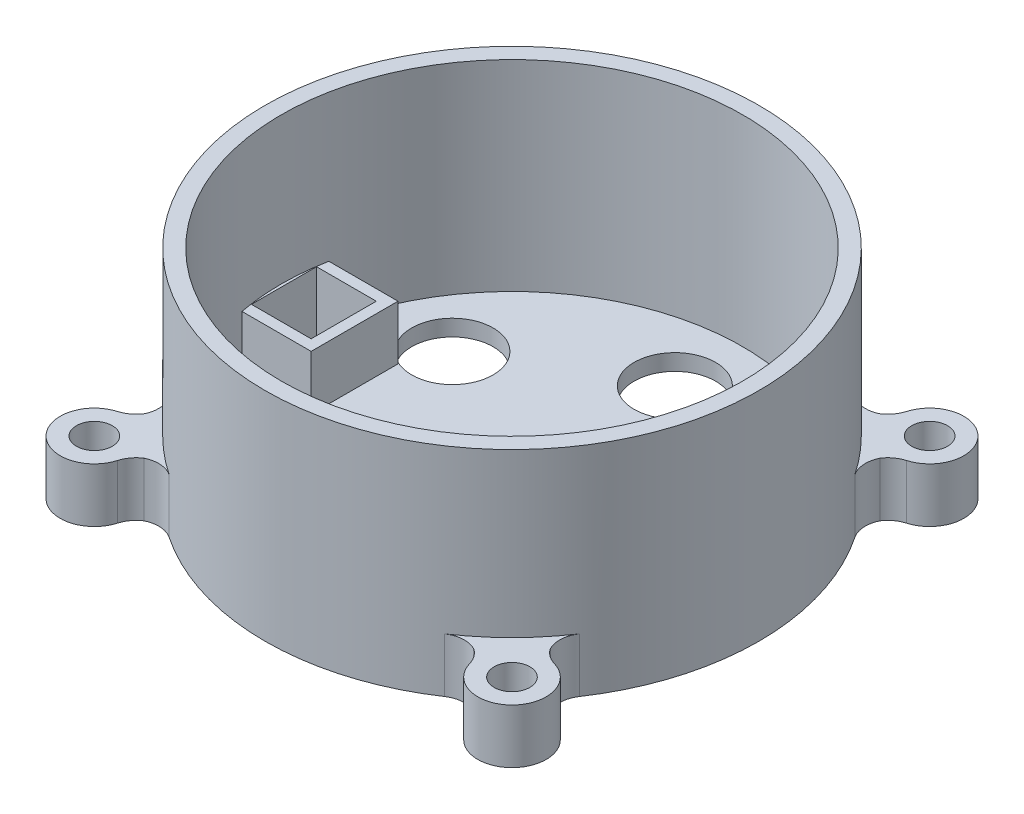
from build123d import *

# Parameters (mm, degrees)
SKETCH1_R               = 45.5
BOSS_EXTRUDE1_DEPTH     = 40
SHELL1_T                = -3
CUT_EXTRUDE2_DEPTH      = 76.766087401
CUT_EXTRUDE2_DEPTH_BACK = 76.766087401
SKETCH3_R               = 7.5
SKETCH4_R               = 3
CUT_EXTRUDE3_DEPTH      = 3
SKETCH6_W               = 15
SKETCH6_H               = 16
SKETCH6_W_2             = 11
SKETCH6_H_2             = 12
BOSS_EXTRUDE2_DEPTH     = 10
SKETCH7_W               = 11
SKETCH7_H               = 12
CUT_EXTRUDE5_DEPTH      = 3
SKETCH8_R               = 3.3
BOSS_EXTRUDE3_DEPTH     = 10
CIRPATTERN1_COUNT       = 4
FILLET1_R               = 5


with BuildPart() as part:
    # Sketch1 → Boss-Extrude1 (new body)
    with BuildSketch(Plane(origin=(0, 0, 0), x_dir=(1, 0, 0), z_dir=(0, 1, 0))):
        with Locations(Location((0, 0, 0), (0, 0, 270))):
            Circle(SKETCH1_R)
    extrude(amount=BOSS_EXTRUDE1_DEPTH)

    # Shell1
    shell1_openings = [part.faces().sort_by_distance(p)[0] for p in [
        (0, 40, 0),
    ]]
    offset(amount=SHELL1_T, openings=shell1_openings, kind=Kind.INTERSECTION)

    # Sketch3 → Cut-Extrude2 (cut, two sides: drawn at the far end of the back side and taken through both)
    with BuildSketch(Plane.XZ.offset(-CUT_EXTRUDE2_DEPTH_BACK)):
        with Locations(Location((0, 30, 0), (0, 0, 90))):
            Circle(SKETCH3_R)
        with Locations(Location((25.980762114, 15, 0), (0, 0, 90))):
            Circle(SKETCH3_R)
        with Locations(Location((25.980762114, -15, 0), (0, 0, 90))):
            Circle(SKETCH3_R)
        with Locations(Location((0, -30, 0), (0, 0, 90))):
            Circle(SKETCH3_R)
        with Locations(Location((-25.980762114, -15, 0), (0, 0, 90))):
            Circle(SKETCH3_R)
        with Locations(Location((-25.980762114, 15, 0), (0, 0, 90))):
            Circle(SKETCH3_R)
    extrude(amount=CUT_EXTRUDE2_DEPTH + CUT_EXTRUDE2_DEPTH_BACK, mode=Mode.SUBTRACT)

    # Sketch4 → Cut-Extrude3 (cut)
    with BuildSketch(Plane(origin=(0, 3, 0), x_dir=(1, 0, 0), z_dir=(0, 1, 0))):
        with Locations(Location((0, 0, 0), (0, 0, 270))):
            Circle(SKETCH4_R)
    extrude(amount=-CUT_EXTRUDE3_DEPTH, mode=Mode.SUBTRACT)

    # Sketch6 → Boss-Extrude2 (add)
    with BuildSketch(Plane(origin=(0, 3, 0), x_dir=(1, 0, 0), z_dir=(0, 1, 0))):
        with Locations((-36.5, 0)):
            Rectangle(SKETCH6_W, SKETCH6_H)
        with Locations((-36.5, 0)):
            Rectangle(SKETCH6_W_2, SKETCH6_H_2, mode=Mode.SUBTRACT)
    extrude(amount=BOSS_EXTRUDE2_DEPTH)

    # Sketch7 → Cut-Extrude5 (cut)
    with BuildSketch(Plane(origin=(0, 3, 0), x_dir=(1, 0, 0), z_dir=(0, 1, 0))):
        with Locations((-36.5, 0)):
            Rectangle(SKETCH7_W, SKETCH7_H)
    extrude(amount=-CUT_EXTRUDE5_DEPTH, mode=Mode.SUBTRACT)

    # Sketch8 → Boss-Extrude3 (add)
    with BuildSketch(Plane(origin=(0, 0, 0), x_dir=(1, 0, 0), z_dir=(0, 1, 0))):
        with BuildLine():
            Line((32.166608897, 38.466608897), (27.854823504, 35.97719844))
            ThreePointArc((27.854823504, 35.97719844), (32.173358544, 32.173358544), (35.97719844, 27.854823504))
            Line((35.97719844, 27.854823504), (38.466608897, 32.166608897))
            ThreePointArc((38.466608897, 32.166608897), (42.921381618, 42.921381618), (32.166608897, 38.466608897))
        make_face()
        with Locations(Location((38.466608897, 38.466608897, 0), (0, 0, 270))):
            Circle(SKETCH8_R, mode=Mode.SUBTRACT)
    boss_extrude3 = extrude(amount=BOSS_EXTRUDE3_DEPTH)

    # CirPattern1: Boss-Extrude3 ×4 about axis
    cirpattern1_axis = Axis((0, 0, 0), (0, 1, 0))
    for i in range(1, CIRPATTERN1_COUNT):
        add(boss_extrude3.rotate(cirpattern1_axis, i * 360 / CIRPATTERN1_COUNT))

    # Fillet1
    # the kernel refuses this fillet: 5 mm, written as the material it adds along each edge
    with BuildSketch(Plane(origin=(-38.466608897, 0, 32.166608897), x_dir=(0.5000000000000063, 0, -0.866025403784435), z_dir=(0, 1, 0)), Plane(origin=(32.166608897, 0, 38.466608897), x_dir=(-0.8660254037844374, 0, -0.5000000000000022), z_dir=(0, 1, 0)), Plane(origin=(38.466608897, 0, -32.166608897), x_dir=(-0.5000000000000032, 0, 0.8660254037844368), z_dir=(0, 1, 0)), Plane(origin=(-32.166608897, 0, -38.466608897), x_dir=(0.8660254037844356, 0, 0.5000000000000054), z_dir=(0, 1, 0))) as fillet1_piece_1:
        with BuildLine():
            CenterArc((2.371395832, 5), FILLET1_R, 226.156864412, 43.843135588)
            ThreePointArc((-1.092035972, 1.39380531), (-0.496806454, 0.735459519), (0, 0))
            Line((0, 0), (2.371395832, 0))
        make_face()
    extrude(amount=10)
    with BuildSketch(Plane(origin=(-32.166608897, 0, 38.466608897), x_dir=(0.8660254037844327, 0, -0.5000000000000103), z_dir=(0, 1, 0)), Plane(origin=(38.466608897, 0, 32.166608897), x_dir=(-0.5000000000000117, 0, -0.8660254037844319), z_dir=(0, 1, 0)), Plane(origin=(32.166608897, 0, -38.466608897), x_dir=(-0.8660254037844319, 0, 0.5000000000000117), z_dir=(0, 1, 0)), Plane(origin=(-38.466608897, 0, -32.166608897), x_dir=(0.500000000000011, 0, 0.8660254037844324), z_dir=(0, 1, 0))) as fillet1_piece_2:
        with BuildLine():
            CenterArc((2.371395832, -5), FILLET1_R, 90, 43.843135588)
            ThreePointArc((-1.092035972, -1.39380531), (-0.496806454, -0.735459519), (0, 0))
            Line((0, 0), (2.371395832, 0))
        make_face()
    extrude(amount=10)
    with BuildSketch(Plane(origin=(-27.854823504, 0, 35.97719844), x_dir=(0.8108999282777639, 0, 0.5851848479917412), z_dir=(0, 1, 0)), Plane(origin=(35.97719844, 0, 27.854823504), x_dir=(0.5851848479917567, 0, -0.8108999282777527), z_dir=(0, 1, 0)), Plane(origin=(27.854823504, 0, -35.97719844), x_dir=(-0.8108999282777679, 0, -0.5851848479917359), z_dir=(0, 1, 0)), Plane(origin=(-35.97719844, 0, -27.854823504), x_dir=(-0.5851848479917252, 0, 0.8108999282777755), z_dir=(0, 1, 0))) as fillet1_piece_3:
        with BuildLine():
            CenterArc((3.236915302, -4.997156955), FILLET1_R, 91.932257762, 63.883791986)
            Line((-1.32425924, -2.948819386), (0, 0))
            ThreePointArc((0, 0), (1.534162982, -0.025871708), (3.068325963, 0))
        make_face()
    extrude(amount=10)
    with BuildSketch(Plane(origin=(-35.97719844, 0, 27.854823504), x_dir=(-0.5851848479917389, 0, -0.8108999282777657), z_dir=(0, 1, 0)), Plane(origin=(27.854823504, 0, 35.97719844), x_dir=(-0.8108999282777541, 0, 0.5851848479917549), z_dir=(0, 1, 0)), Plane(origin=(35.97719844, 0, -27.854823504), x_dir=(0.5851848479917436, 0, 0.8108999282777621), z_dir=(0, 1, 0)), Plane(origin=(-27.854823504, 0, -35.97719844), x_dir=(0.8108999282777745, 0, -0.5851848479917268), z_dir=(0, 1, 0))) as fillet1_piece_4:
        with BuildLine():
            CenterArc((3.236915302, 4.997156955), FILLET1_R, 204.183950253, 63.883791986)
            Line((-1.32425924, 2.948819386), (0, 0))
            ThreePointArc((0, 0), (1.534162982, 0.025871708), (3.068325963, 0))
        make_face()
    extrude(amount=10)


solid = part.part
